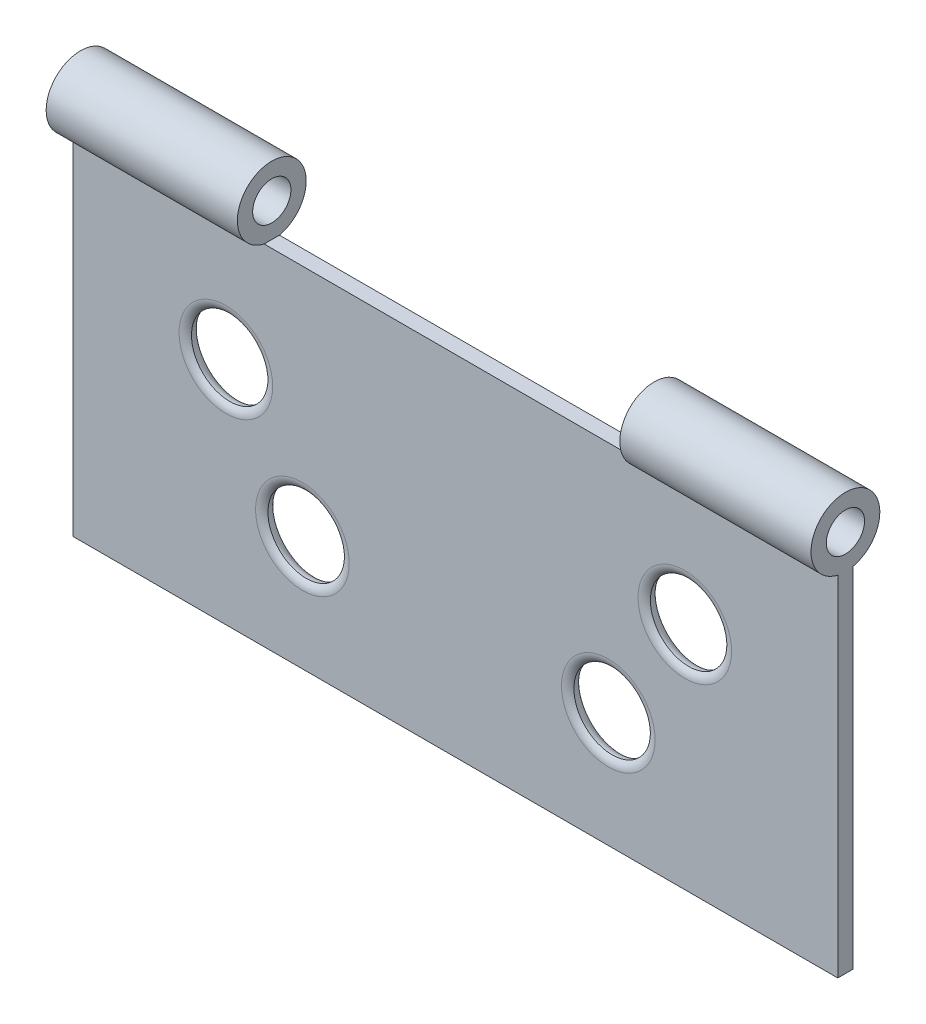
from build123d import *
from build123d.topology import SkipClean

# Parameters (mm, degrees)
ESBO_O1_W                  = 10
ESBO_O1_H                  = 5
ESBO_O1_R                  = 0.5
RESSALTO_EXTRUS_O1_DEPTH   = 0.2
FILETE1_R                  = 0.15
FILETE2_R                  = 0.15
ESBO_O2_R                  = 0.45
ESBO_O2_R_2                = 0.25
RESSALTO_EXTRUS_O2_DEPTH   = 10
CORTE_EXTRUS_O1_DEPTH      = 10
CORTE_EXTRUS_O2_DEPTH      = 10
CORTE_EXTRUS_O2_DEPTH_BACK = 10
ESBO_O4_W                  = 5
ESBO_O4_H                  = 1.5


with BuildPart() as part:
    # Esboço1 → Ressalto-extrusão1 (new body)
    with BuildSketch(Plane.XY):
        with Locations((-14.692885356, 5.686498983)):
            Rectangle(ESBO_O1_W, ESBO_O1_H)
        with Locations((-11.692885356, 6.18958374)):
            Circle(ESBO_O1_R, mode=Mode.SUBTRACT)
        with Locations((-12.692885356, 4.688041362)):
            Circle(ESBO_O1_R, mode=Mode.SUBTRACT)
        with Locations((-17.692885356, 6.18958374)):
            Circle(ESBO_O1_R, mode=Mode.SUBTRACT)
        with Locations((-16.692885356, 4.686498983)):
            Circle(ESBO_O1_R, mode=Mode.SUBTRACT)
    extrude(amount=RESSALTO_EXTRUS_O1_DEPTH)

    # Filete1
    filete1_edges = [part.edges().sort_by_distance(p)[0] for p in [
        (-12.192885356, 6.18958374, 0),
        (-13.192885356, 4.688041362, 0),
        (-18.192885356, 6.18958374, 0),
        (-17.192885356, 4.686498983, 0),
    ]]
    fillet(filete1_edges, radius=FILETE1_R)

    # Filete2
    # the kernel refuses this fillet: 0.15 mm, written as the material it takes off along each edge
    with BuildSketch(Plane(origin=(-17.692885356, 6.18958374, 0.2), x_dir=(1, 0, 0), z_dir=(0, -1, 0))) as filete2_piece_1:
        with BuildLine():
            CenterArc((0.611803399, -0.15), FILETE2_R, 90, 48.189685104)
            Line((0.5, -0.05), (0.497763932, -0.048))
            ThreePointArc((0.497763932, -0.048), (0.497, -0.025), (0.497, 0))
            Line((0.497, 0), (0.5, 0.003))
            Line((0.5, 0.003), (0.611803399, 0.003))
            Line((0.611803399, 0.003), (0.611803399, 0))
        make_face()
    revolve(axis=Axis((-17.692885356, 6.18958374, 0.2), (0, 0, 1)), mode=Mode.SUBTRACT)
    with BuildSketch(Plane(origin=(-12.692885356, 4.688041362, 0.2), x_dir=(1, 0, 0), z_dir=(0, -1, 0))) as filete2_piece_2:
        with BuildLine():
            CenterArc((0.611803399, -0.15), FILETE2_R, 90, 48.189685104)
            Line((0.5, -0.05), (0.497763932, -0.048))
            ThreePointArc((0.497763932, -0.048), (0.497, -0.025), (0.497, 0))
            Line((0.497, 0), (0.5, 0.003))
            Line((0.5, 0.003), (0.611803399, 0.003))
            Line((0.611803399, 0.003), (0.611803399, 0))
        make_face()
    revolve(axis=Axis((-12.692885356, 4.688041362, 0.2), (0, 0, 1)), mode=Mode.SUBTRACT)
    with BuildSketch(Plane(origin=(-11.692885356, 6.18958374, 0.2), x_dir=(1, 0, 0), z_dir=(0, -1, 0))) as filete2_piece_3:
        with BuildLine():
            CenterArc((0.611803399, -0.15), FILETE2_R, 90, 48.189685104)
            Line((0.611803399, 0), (0.611803399, 0.003))
            Line((0.611803399, 0.003), (0.5, 0.003))
            Line((0.5, 0.003), (0.497, 0))
            ThreePointArc((0.497, 0), (0.497, -0.025), (0.497763932, -0.048))
            Line((0.497763932, -0.048), (0.5, -0.05))
        make_face()
    revolve(axis=Axis((-11.692885356, 6.18958374, 0.2), (0, 0, 1)), mode=Mode.SUBTRACT)
    with BuildSketch(Plane(origin=(-16.692885356, 4.686498983, 0.2), x_dir=(1, 0, 0), z_dir=(0, -1, 0))) as filete2_piece_4:
        with BuildLine():
            CenterArc((0.611803399, -0.15), FILETE2_R, 90, 48.189685104)
            Line((0.5, -0.05), (0.497763932, -0.048))
            ThreePointArc((0.497763932, -0.048), (0.497, -0.025), (0.497, 0))
            Line((0.497, 0), (0.5, 0.003))
            Line((0.5, 0.003), (0.611803399, 0.003))
            Line((0.611803399, 0.003), (0.611803399, 0))
        make_face()
    revolve(axis=Axis((-16.692885356, 4.686498983, 0.2), (0, 0, 1)), mode=Mode.SUBTRACT)

    # Esboço2 → Ressalto-extrusão2 (add)
    with BuildSketch(Plane(origin=(-9.692885356, 0, 0), x_dir=(0, 0, -1), z_dir=(1, 0, 0))):
        with Locations((-0.1, 8.186498983)):
            Circle(ESBO_O2_R)
        with Locations((-0.1, 8.186498983)):
            Circle(ESBO_O2_R_2, mode=Mode.SUBTRACT)
    extrude(amount=-RESSALTO_EXTRUS_O2_DEPTH)

    # Esboço3 → Corte-extrusão1 (cut)
    with SkipClean():  # the faces are left unmerged after this step: merging them gives an invalid solid
        with BuildSketch(Plane(origin=(-9.692885356, 0, 0), x_dir=(0, 0, -1), z_dir=(1, 0, 0))):
            with BuildLine():
                Line((-0.2, 8.186498983), (-0.2, 7.957370198))
                ThreePointArc((-0.2, 7.957370198), (-0.1, 8.436498983), (0, 7.957370198))
                Line((0, 7.957370198), (0, 8.186498983))
                Line((0, 8.186498983), (-0.2, 8.186498983))
            make_face()
            with BuildLine():
                Line((0, 8.186498983), (0, 7.957370198))
                ThreePointArc((0, 7.957370198), (0.109165007, 8.049568344), (0.15, 8.186498983))
                ThreePointArc((0.15, 8.186498983), (-0.236930639, 8.39566399), (-0.2, 7.957370198))
                Line((-0.2, 7.957370198), (-0.2, 8.186498983))
                Line((-0.2, 8.186498983), (0, 8.186498983))
            make_face()
            with BuildLine():
                ThreePointArc((-0.2, 7.957370198), (-0.1, 7.936498983), (0, 7.957370198))
                Line((0, 7.957370198), (0, 8.186498983))
                Line((0, 8.186498983), (-0.2, 8.186498983))
                Line((-0.2, 8.186498983), (-0.2, 7.957370198))
            make_face()
        extrude(amount=-CORTE_EXTRUS_O1_DEPTH, mode=Mode.SUBTRACT)

    # Esboço4 → Corte-extrusão2 (cut, two sides: drawn at the far end of the back side and taken through both)
    with BuildSketch(Plane(origin=(0, 0, 0), x_dir=(-1, 0, 0), z_dir=(0, 0, -1)).offset(-CORTE_EXTRUS_O2_DEPTH_BACK)):
        with Locations((14.692885356, 8.497750764)):
            Rectangle(ESBO_O4_W, ESBO_O4_H)
    extrude(amount=CORTE_EXTRUS_O2_DEPTH + CORTE_EXTRUS_O2_DEPTH_BACK, mode=Mode.SUBTRACT)


solid = part.part
